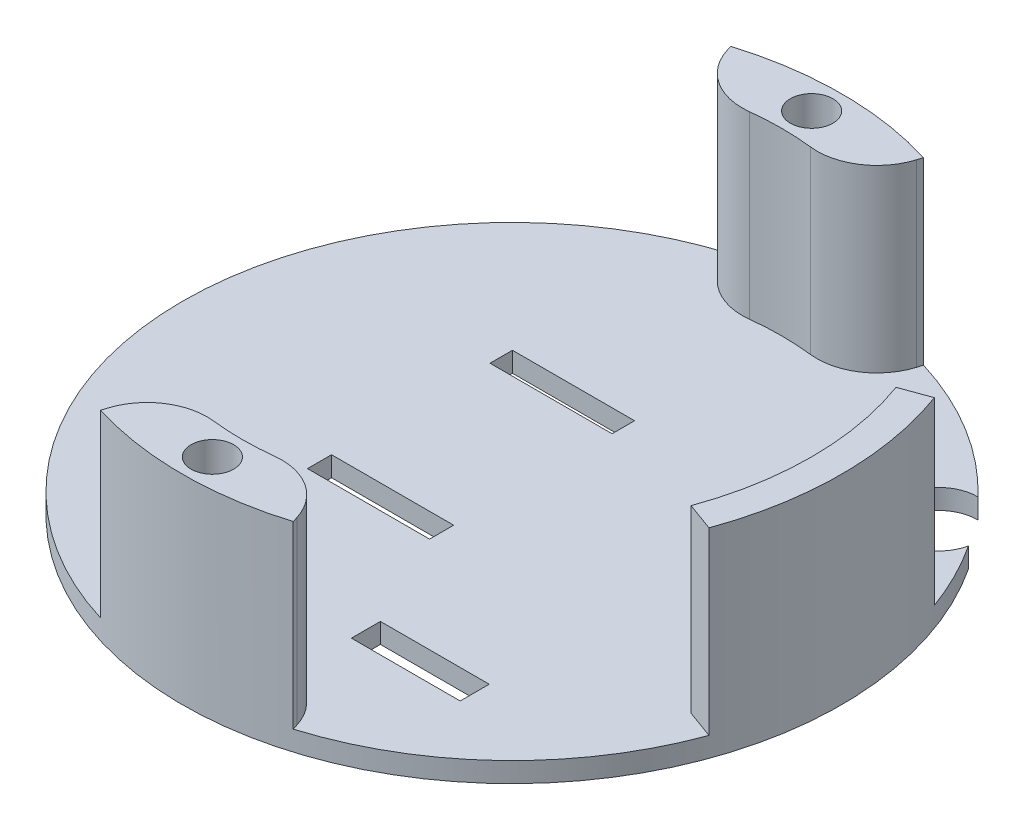
from build123d import *

# Parameters (mm, degrees)
SKETCH2_R               = 69.85
BOSS_EXTRUDE1_DEPTH     = 4.233333
BOSS_EXTRUDE2_DEPTH     = 38.1
FILLET3_R               = 12.7
FILLET4_R               = 12.7
FILLET5_R               = 12.7
BOSS_EXTRUDE3_DEPTH     = 38.1
CUT_EXTRUDE1_DEPTH      = 108.471653
CUT_EXTRUDE1_DEPTH_BACK = 108.471653
SKETCH5_R               = 4.5085
FILLET6_R               = 12.7
CUT_EXTRUDE2_DEPTH      = 106.875658
CUT_EXTRUDE2_DEPTH_BACK = 106.875658
SKETCH6_R               = 8.255
SKETCH6_W               = 25.881766
SKETCH6_H               = 4.761909
SKETCH6_H_2             = 5.102046
SKETCH6_W_2             = 23.059325
SKETCH6_H_3             = 6.149153


with BuildPart() as part:
    # Sketch2 → Boss-Extrude1 (new body)
    with BuildSketch(Plane(origin=(0, 0, 0), x_dir=(1, 0, 0), z_dir=(0, 1, 0))):
        Circle(SKETCH2_R)
    extrude(amount=BOSS_EXTRUDE1_DEPTH)

    # Sketch3 → Boss-Extrude2 (add)
    with BuildSketch(Plane(origin=(0, 4.233333, 0), x_dir=(1, 0, 0), z_dir=(0, 1, 0))):
        with BuildLine():
            Line((-16.709043, -54.652817), (-20.422164, -66.797887))
            ThreePointArc((-20.422164, -66.797887), (0, -69.85), (20.422164, -66.797887))
            Line((20.422164, -66.797887), (16.709043, -54.652817))
            ThreePointArc((16.709043, -54.652817), (0, -57.15), (-16.709043, -54.652817))
        make_face()
        with BuildLine():
            ThreePointArc((20.422164, 66.797887), (0, 69.85), (-20.422164, 66.797887))
            Line((-20.422164, 66.797887), (-16.709043, 54.652817))
            ThreePointArc((-16.709043, 54.652817), (0, 57.15), (16.709043, 54.652817))
            Line((16.709043, 54.652817), (20.422164, 66.797887))
        make_face()
    extrude(amount=BOSS_EXTRUDE2_DEPTH)

    # Fillet3
    fillet3_edges = [part.edges().sort_by_distance(p)[0] for p in [
        (-16.709043, 23.283333, -54.652817),
    ]]
    fillet(fillet3_edges, radius=FILLET3_R)

    # Fillet4
    fillet4_edges = [part.edges().sort_by_distance(p)[0] for p in [
        (16.709043, 23.283333, 54.652817),
    ]]
    fillet(fillet4_edges, radius=FILLET4_R)

    # Fillet5
    fillet5_edges = [part.edges().sort_by_distance(p)[0] for p in [
        (-16.709043, 23.283333, 54.652817),
    ]]
    fillet(fillet5_edges, radius=FILLET5_R)

    # Sketch4 → Boss-Extrude3 (add)
    with BuildSketch(Plane(origin=(0, 4.233333, 0), x_dir=(1, 0, 0), z_dir=(0, 1, 0))):
        with BuildLine():
            Line((59.670481, 21.718279), (65.63753, 23.890107))
            ThreePointArc((65.63753, 23.890107), (69.85, 0), (65.63753, -23.890107))
            Line((65.63753, -23.890107), (59.670481, -21.718279))
            ThreePointArc((59.670481, -21.718279), (63.5, 0), (59.670481, 21.718279))
        make_face()
    extrude(amount=BOSS_EXTRUDE3_DEPTH)

    # Sketch5 → Cut-Extrude1 (cut, two sides: drawn at the far end of the back side and taken through both)
    with BuildSketch(Plane(origin=(0, 42.333333, 0), x_dir=(1, 0, 0), z_dir=(0, 1, 0)).offset(-CUT_EXTRUDE1_DEPTH_BACK)):
        with Locations((0, 63.5)):
            Circle(SKETCH5_R)
        with Locations((0, -63.5)):
            Circle(SKETCH5_R)
    extrude(amount=CUT_EXTRUDE1_DEPTH + CUT_EXTRUDE1_DEPTH_BACK, mode=Mode.SUBTRACT)

    # Fillet6
    fillet6_edges = [part.edges().sort_by_distance(p)[0] for p in [
        (16.709043, 23.283333, -54.652817),
    ]]
    fillet(fillet6_edges, radius=FILLET6_R)

    # Sketch6 → Cut-Extrude2 (cut, two sides: drawn at the far end of the back side and taken through both)
    with BuildSketch(Plane(origin=(0, 4.233333, 0), x_dir=(1, 0, 0), z_dir=(0, 1, 0)).offset(-CUT_EXTRUDE2_DEPTH_BACK)):
        with Locations((50.292, 40.132)):
            Circle(SKETCH6_R)
        with Locations((-12.940883, 23.595396)):
            Rectangle(SKETCH6_W, SKETCH6_H)
        with Locations((-12.940883, -14.918752)):
            Rectangle(SKETCH6_W, SKETCH6_H_2)
        with Locations((21.426465, -40.859226)):
            Rectangle(SKETCH6_W_2, SKETCH6_H_3)
    extrude(amount=CUT_EXTRUDE2_DEPTH + CUT_EXTRUDE2_DEPTH_BACK, mode=Mode.SUBTRACT)


solid = part.part
